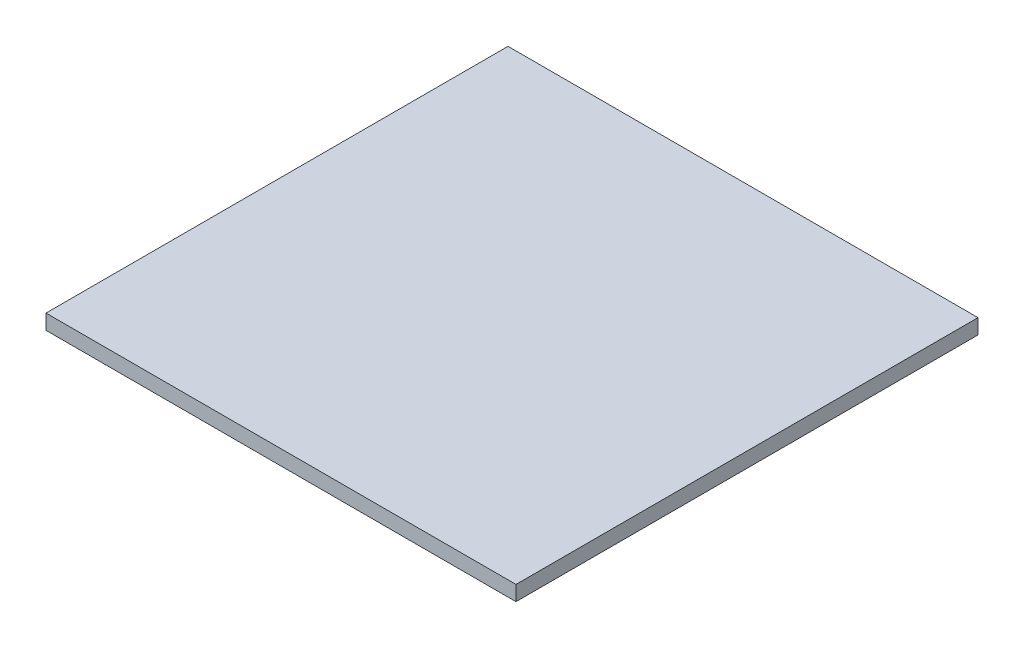
from build123d import *

# Parameters (mm, degrees)
SKETCH1_W           = 100.5
SKETCH1_H           = 98.8
BOSS_EXTRUDE1_DEPTH = 3.2


with BuildPart() as part:
    # Sketch1 → Boss-Extrude1 (new body)
    with BuildSketch(Plane(origin=(0, 0, 0), x_dir=(1, 0, 0), z_dir=(0, 1, 0))):
        with Locations((5.968457944, -28.701985981)):
            Rectangle(SKETCH1_W, SKETCH1_H)
    extrude(amount=BOSS_EXTRUDE1_DEPTH)


solid = part.part
